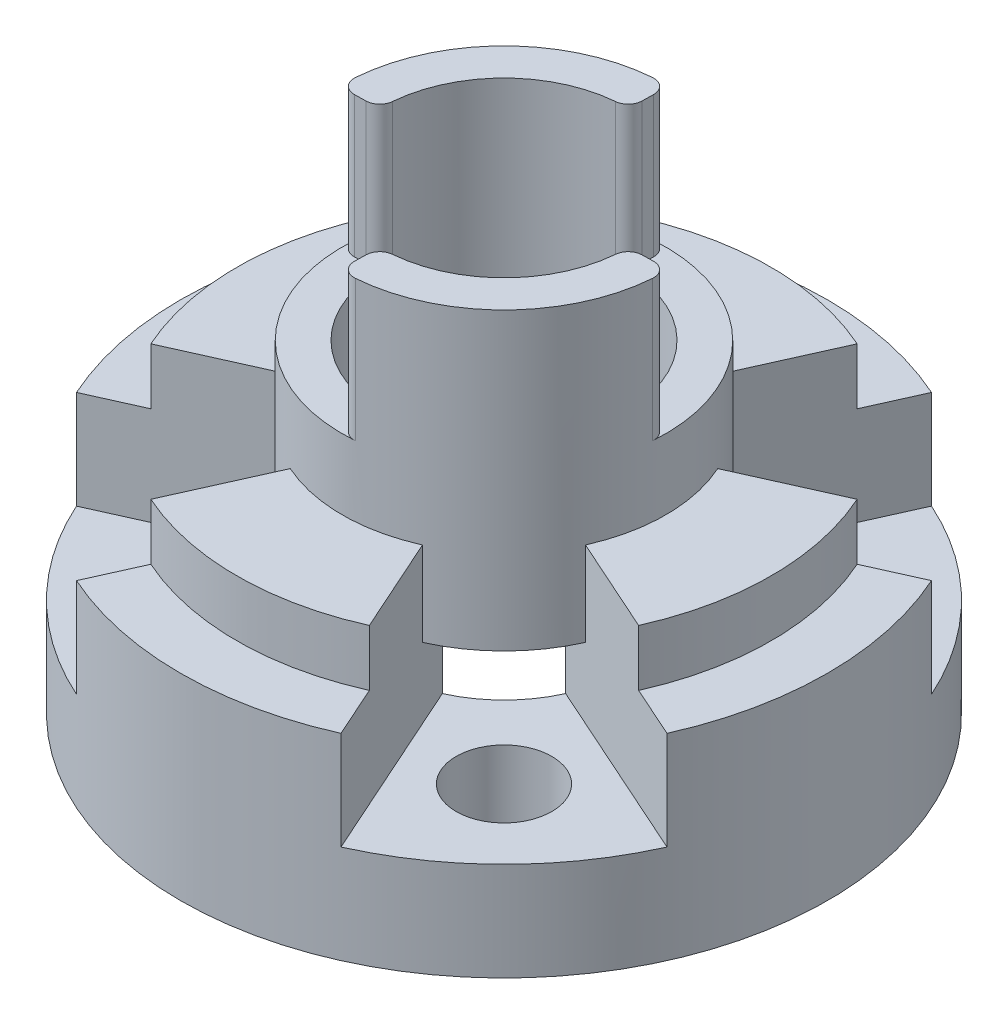
from build123d import *

# Parameters (mm, degrees)
CROQUIS1_R              = 11.5
CROQUIS1_R_2            = 4.35
CROQUIS1_R_3            = 1.7000000000000004
SALIENTE_EXTRUIR1_DEPTH = 3.5
CROQUIS2_R              = 5.75
CROQUIS2_R_2            = 4.35
SALIENTE_EXTRUIR2_DEPTH = 13
CORTAR_EXTRUIR1_START   = -5
CORTAR_EXTRUIR1_DEPTH   = 5
CROQUIS4_R              = 5.275
CROQUIS4_R_2            = 4.35
CORTAR_EXTRUIR2_DEPTH   = 2
REDONDEO1_R             = 0.6
REDONDEO2_R             = 0.5
SALIENTE_EXTRUIR3_DEPTH = 3.5
SALIENTE_EXTRUIR4_DEPTH = 2
CORTAR_EXTRUIR3_DEPTH   = 2.5


with BuildPart() as part:
    # Croquis1 → Saliente-Extruir1 (new body)
    with BuildSketch(Plane(origin=(0, 0, 0), x_dir=(1, 0, 0), z_dir=(0, 1, 0))):
        with Locations(Location((1.731948e-11, 0, 0), (0, 0, 270))):
            Circle(CROQUIS1_R)
        with Locations(Location((1.731948e-11, 0, 0), (0, 0, 270))):
            Circle(CROQUIS1_R_2, mode=Mode.SUBTRACT)
        with Locations(Location((5.656854249492441, 5.65685424949238, 0), (0, 0, 270))):
            Circle(CROQUIS1_R_3, mode=Mode.SUBTRACT)
        with Locations(Location((-5.656854249492318, 5.656854249492381, 0), (0, 0, 270))):
            Circle(CROQUIS1_R_3, mode=Mode.SUBTRACT)
        with Locations(Location((-5.656854249492318, -5.656854249492381, 0), (0, 0, 270))):
            Circle(CROQUIS1_R_3, mode=Mode.SUBTRACT)
        with Locations(Location((5.656854249492441, -5.65685424949238, 0), (0, 0, 270))):
            Circle(CROQUIS1_R_3, mode=Mode.SUBTRACT)
    extrude(amount=SALIENTE_EXTRUIR1_DEPTH)

    # Croquis2 → Saliente-Extruir2 (add)
    with BuildSketch(Plane(origin=(0, 3.5, 0), x_dir=(1, 0, 0), z_dir=(0, 1, 6e-17))):
        with Locations(Location((1.731948e-11, 0, 0), (0, 0, 90))):
            Circle(CROQUIS2_R)
        with Locations(Location((1.731948e-11, 0, 0), (0, 0, 270))):
            Circle(CROQUIS2_R_2, mode=Mode.SUBTRACT)
    extrude(amount=SALIENTE_EXTRUIR2_DEPTH)

    # Croquis3 → Cortar-Extruir1 (cut)
    with BuildSketch(Plane(origin=(0, 16.5, 1.01e-15), x_dir=(1, 0, 0), z_dir=(0, 1, 6e-17)).offset(CORTAR_EXTRUIR1_START)):
        with BuildLine():
            Line((-5.7491242471489485, -0.10035133701439494), (-4.3493374739299995, -0.07591796800219403))
            ThreePointArc((-4.3493374739299995, -0.07591796800219403), (-3.0759144981612514, -3.0759144981612847), (-0.07591796800214497, -4.34933747393))
            Line((-0.07591796800214497, -4.34933747393), (-0.10035133701433126, -5.7491242471489485))
            ThreePointArc((-0.10035133701433126, -5.7491242471489485), (-4.065863991822413, -4.065863991822457), (-5.7491242471489485, -0.10035133701439494))
        make_face()
        with BuildLine():
            Line((5.749124247183587, 0.10035133701435339), (4.349337473964638, 0.07591796800216172))
            ThreePointArc((4.349337473964638, 0.07591796800216172), (3.075914498198222, 3.0759144981732933), (0.07591796803681536, 4.3493374739299995))
            Line((0.07591796803681536, 4.3493374739299995), (0.10035133704901177, 5.749124247148948))
            ThreePointArc((0.10035133704901177, 5.749124247148948), (4.06586399185939, 4.065863991834459), (5.749124247183587, 0.10035133701435339))
        make_face()
    extrude(amount=CORTAR_EXTRUIR1_DEPTH, mode=Mode.SUBTRACT)

    # Croquis4 → Cortar-Extruir2 (cut)
    with BuildSketch(Plane.XZ):
        with Locations(Location((1.731948e-11, 0, 0), (0, 0, 270))):
            Circle(CROQUIS4_R)
        with Locations(Location((1.731948e-11, 0, 0), (0, 0, 270))):
            Circle(CROQUIS4_R_2, mode=Mode.SUBTRACT)
    extrude(amount=-CORTAR_EXTRUIR2_DEPTH, mode=Mode.SUBTRACT)

    # Redondeo1
    redondeo1_edges = [part.edges().sort_by_distance(p)[0] for p in [
        (1.732109e-11, 0, 5.275),
    ]]
    fillet(redondeo1_edges, radius=REDONDEO1_R)

    # Redondeo2
    # the kernel refuses this fillet: 0.5 mm, written as the material it takes off along each edge
    with BuildSketch(Plane(origin=(-0.10035133701433126, 11.5, 5.749124247148949), x_dir=(0.017452406437275973, 0, -0.9998476951563914), z_dir=(0, 1, 6e-17))) as redondeo2_piece_1:
        with BuildLine():
            CenterArc((0.5238637599066267, -0.5000000000000001), REDONDEO2_R, 90.00000000000004, 95.46502379971594)
            ThreePointArc((0.02613649894535296, -0.5476190476173979), (0.00653784155089456, -0.27412120398217477), (0, 0))
            Line((0, 0), (0.5238637599066264, 0))
        make_face()
    extrude(amount=6.3706060199107775, mode=Mode.SUBTRACT)
    with BuildSketch(Plane(origin=(-5.7491242471489485, 11.5, 0.10035133701439544), x_dir=(0.9998476951563913, 0, -0.01745240643728594), z_dir=(0, 1, 6e-17))) as redondeo2_piece_2:
        with BuildLine():
            CenterArc((0.5238637599253263, 0.5), REDONDEO2_R, 174.53497620009085, 95.46502379990915)
            ThreePointArc((0.02613649896421286, 0.5476190476190762), (0.00653784156877282, 0.2741212039826321), (0, 0))
            Line((0, 0), (0.5238637599253264, 0))
        make_face()
    extrude(amount=6.3706060199172185, mode=Mode.SUBTRACT)
    with BuildSketch(Plane(origin=(-4.3493374739299995, 11.5, 0.07591796800219473), x_dir=(0.03417818793243372, 0, -0.9994157550637548), z_dir=(0, 1, 6e-17))) as redondeo2_piece_3:
        with BuildLine():
            CenterArc((0.4748597695855003, 0.4993335237901514), REDONDEO2_R, 182.95864737806363, 84.08270524821285)
            Line((-0.02447375420269609, 0.47352592759711776), (0, 0))
            ThreePointArc((0, 0), (0.22452608671492605, 0.00579834302568299), (0.4490521734302907, 0))
        make_face()
    extrude(amount=6.18539489398967, mode=Mode.SUBTRACT)
    with BuildSketch(Plane(origin=(-0.07591796800214483, 11.5, 4.34933747393), x_dir=(0.9994157550651794, 0, -0.03417818789077768), z_dir=(0, 1, 6e-17))) as redondeo2_piece_4:
        with BuildLine():
            CenterArc((0.4748597696053468, -0.4993335237891691), REDONDEO2_R, 92.95864737590307, 84.082705248422)
            Line((-0.02447375418392556, -0.47352592761695317), (0, 0))
            ThreePointArc((0, 0), (0.22452608671557137, -0.0057983430342235), (0.44905217343114273, 0))
        make_face()
    extrude(amount=6.185394894036769, mode=Mode.SUBTRACT)
    with BuildSketch(Plane(origin=(0.10035133704901178, 11.5, -5.749124247148948), x_dir=(-0.017452406437283147, 0, 0.9998476951563912), z_dir=(0, 1, 6e-17))) as redondeo2_piece_5:
        with BuildLine():
            CenterArc((0.5238637599066267, -0.49999999999999994), REDONDEO2_R, 90.00000000000004, 95.46502379971594)
            ThreePointArc((0.02613649894535335, -0.5476190476173982), (0.00653784155089565, -0.27412120398217554), (0, 0))
            Line((0, 0), (0.5238637599066264, 0))
        make_face()
    extrude(amount=6.370606019910781, mode=Mode.SUBTRACT)
    with BuildSketch(Plane(origin=(5.749124247183587, 11.5, -0.10035133701435296), x_dir=(-0.9998476951563913, 0, 0.017452406437280254), z_dir=(0, 1, 6e-17))) as redondeo2_piece_6:
        with BuildLine():
            CenterArc((0.5238637599253252, 0.5000000000000001), REDONDEO2_R, 174.53497620009054, 95.46502379990937)
            ThreePointArc((0.02613649896421246, 0.5476190476190788), (0.00653784156877128, 0.27412120398263345), (0, 0))
            Line((0, 0), (0.5238637599253245, 0))
        make_face()
    extrude(amount=6.370606019917222, mode=Mode.SUBTRACT)
    with BuildSketch(Plane(origin=(4.349337473964638, 11.5, -0.07591796800216102), x_dir=(-0.03417818793243961, 0, 0.9994157550637546), z_dir=(0, 1, 6e-17))) as redondeo2_piece_7:
        with BuildLine():
            CenterArc((0.4748597695855018, 0.49933352379015083), REDONDEO2_R, 182.9586473780635, 84.08270524821285)
            Line((-0.02447375420269471, 0.4735259275971186), (0, 0))
            ThreePointArc((0, 0), (0.22452608671492558, 0.00579834302568341), (0.4490521734302912, 0))
        make_face()
    extrude(amount=6.185394893989674, mode=Mode.SUBTRACT)
    with BuildSketch(Plane(origin=(0.07591796803681525, 11.5, -4.349337473929999), x_dir=(-0.9994157550651797, 0, 0.03417818789076981), z_dir=(0, 1, 6e-17))) as redondeo2_piece_8:
        with BuildLine():
            CenterArc((0.47485976960534654, -0.4993335237891697), REDONDEO2_R, 92.9586473759031, 84.0827052484222)
            Line((-0.02447375418392593, -0.4735259276169559), (0, 0))
            ThreePointArc((0, 0), (0.22452608671556917, -0.00579834303422432), (0.4490521734311421, 0))
        make_face()
    extrude(amount=6.185394894036776, mode=Mode.SUBTRACT)

    # Croquis5 → Saliente-Extruir3 (add)
    with BuildSketch(Plane(origin=(0, 3.5, 0), x_dir=(1, 0, 0), z_dir=(0, 1, 6e-17))):
        with BuildLine():
            ThreePointArc((10.4951389110437, -4.701282722647084), (11.500000000017316, 2.423062e-11), (10.495138911023886, 4.701282722691312))
            Line((10.495138911023888, 4.701282722691313), (5.247569455520605, 2.350641361345657))
            ThreePointArc((5.247569455520605, 2.3506413613456574), (5.7500000000173195, 1.211642e-11), (5.247569455530511, -2.350641361323542))
            Line((5.247569455530511, -2.3506413613235417), (10.495138911043702, -4.701282722647084))
        make_face()
        with BuildLine():
            ThreePointArc((-4.701282722629764, -10.495138911026384), (4.155054e-11, -11.500000000000004), (4.701282722708632, -10.495138911006572))
            Line((4.701282722708633, -10.495138911006569), (2.3506413613629764, -5.247569455503285))
            ThreePointArc((2.3506413613629777, -5.247569455503285), (2.943645e-11, -5.75), (-2.350641361306222, -5.247569455513191))
            Line((-2.350641361306222, -5.247569455513191), (-4.701282722629764, -10.495138911026382))
        make_face()
        with BuildLine():
            ThreePointArc((4.701282722664406, 10.49513891102638), (-6.91114e-12, 11.5), (-4.701282722673994, 10.49513891100657))
            Line((-4.701282722673993, 10.495138911006569), (-2.3506413613283366, 5.247569455503284))
            ThreePointArc((-2.3506413613283352, 5.247569455503285), (5.20506e-12, 5.750000000000002), (2.3506413613408625, 5.24756945551319))
            Line((2.3506413613408625, 5.24756945551319), (4.701282722664406, 10.49513891102638))
        make_face()
        with BuildLine():
            ThreePointArc((-10.495138911009063, 4.7012827226470835), (-11.499999999982684, -2.423151e-11), (-10.49513891098925, -4.701282722691313))
            Line((-10.49513891098925, -4.701282722691314), (-5.247569455485966, -2.3506413613456574))
            ThreePointArc((-5.247569455485966, -2.3506413613456587), (-5.7499999999826805, -1.211753e-11), (-5.247569455495871, 2.3506413613235413))
            Line((-5.247569455495872, 2.3506413613235413), (-10.495138911009063, 4.7012827226470835))
        make_face()
    extrude(amount=SALIENTE_EXTRUIR3_DEPTH)

    # Croquis7 → Saliente-Extruir4 (add)
    with BuildSketch(Plane(origin=(0, 7, 4.8e-16), x_dir=(1, 0, 0), z_dir=(0, 1, 6e-17))):
        with BuildLine():
            Line((-5.247569455495871, 2.3506413613235413), (-8.669897361265344, 3.8836683360997637))
            ThreePointArc((-8.669897361265344, 3.8836683360997637), (-9.49999999998268, -2.001727e-11), (-8.669897361248976, -3.883668336136303))
            Line((-8.669897361248976, -3.883668336136303), (-5.247569455485966, -2.3506413613456574))
            ThreePointArc((-5.247569455485966, -2.3506413613456574), (-5.74999999998268, -1.211571e-11), (-5.247569455495871, 2.3506413613235413))
        make_face()
        with BuildLine():
            Line((2.3506413613408608, 5.24756945551319), (3.8836683361170823, 8.669897361282663))
            ThreePointArc((3.8836683361170823, 8.669897361282663), (-2.69837e-12, 9.5), (-3.883668336118984, 8.669897361266296))
            Line((-3.883668336118984, 8.669897361266296), (-2.3506413613283383, 5.247569455503285))
            ThreePointArc((-2.3506413613283383, 5.247569455503285), (5.20341e-12, 5.749999999999999), (2.3506413613408608, 5.24756945551319))
        make_face()
        with BuildLine():
            ThreePointArc((5.2475694555206065, 2.350641361345656), (5.7500000000173195, 1.211553e-11), (5.247569455530511, -2.350641361323542))
            Line((5.24756945553051, -2.3506413613235413), (8.669897361299984, -3.883668336099766))
            ThreePointArc((8.669897361299984, -3.883668336099768), (9.500000000017327, 2.001721e-11), (8.669897361283617, 3.883668336136305))
            Line((8.669897361283617, 3.883668336136302), (5.247569455520605, 2.3506413613456565))
        make_face()
        with BuildLine():
            Line((-2.350641361306222, -5.24756945551319), (-3.8836683360824447, -8.669897361282663))
            ThreePointArc((-3.8836683360824447, -8.669897361282663), (3.733849e-11, -9.5), (3.883668336153622, -8.669897361266296))
            Line((3.883668336153622, -8.669897361266296), (2.350641361362977, -5.247569455503285))
            ThreePointArc((2.350641361362977, -5.247569455503285), (2.943625e-11, -5.749999999999999), (-2.350641361306222, -5.24756945551319))
        make_face()
    extrude(amount=SALIENTE_EXTRUIR4_DEPTH)

    # Croquis8 → Cortar-Extruir3 (cut)
    with BuildSketch(Plane(origin=(0, 3.5, 0), x_dir=(1, 0, 0), z_dir=(0, 1, 6e-17))):
        with BuildLine():
            Line((-5.247569455495871, 2.3506413613235413), (-3.969900370675269, 1.7783112907404188))
            ThreePointArc((-3.969900370675269, 1.7783112907404188), (-3.0759144981506426, 3.075914498155002), (-1.7783112907398269, 3.9699003706850946))
            Line((-1.7783112907398269, 3.9699003706850946), (-2.3506413613283375, 5.247569455503285))
            ThreePointArc((-2.3506413613283375, 5.247569455503285), (-4.065863991813897, 4.065863991814082), (-5.247569455495871, 2.3506413613235413))
        make_face()
        with BuildLine():
            Line((5.247569455520605, 2.350641361345657), (3.969900370702414, 1.7783112907571466))
            ThreePointArc((3.969900370702414, 1.7783112907571466), (3.0759144981723208, 3.075914498167963), (1.778311290757738, 3.9699003706925886))
            Line((1.778311290757738, 3.9699003706925886), (2.3506413613408603, 5.24756945551319))
            ThreePointArc((2.3506413613408603, 5.24756945551319), (4.065863991831401, 4.0658639918312165), (5.247569455520605, 2.350641361345657))
        make_face()
        with BuildLine():
            Line((2.3506413613629764, -5.247569455503285), (1.7783112907744663, -3.9699003706850946))
            ThreePointArc((1.7783112907744663, -3.9699003706850946), (3.0759144981852824, -3.0759144981550013), (3.969900370709908, -1.7783112907404184))
            Line((3.969900370709908, -1.7783112907404184), (5.24756945553051, -2.350641361323541))
            ThreePointArc((5.24756945553051, -2.350641361323541), (4.065863991848536, -4.065863991814081), (2.3506413613629764, -5.247569455503285))
        make_face()
        with BuildLine():
            Line((-5.247569455485965, -2.3506413613456574), (-3.9699003706677742, -1.778311290757147))
            ThreePointArc((-3.9699003706677742, -1.778311290757147), (-3.0759144981376823, -3.0759144981679625), (-1.7783112907230985, -3.9699003706925886))
            Line((-1.7783112907230985, -3.9699003706925886), (-2.350641361306221, -5.247569455513191))
            ThreePointArc((-2.350641361306221, -5.247569455513191), (-4.0658639917967605, -4.0658639918312165), (-5.247569455485965, -2.3506413613456574))
        make_face()
    extrude(amount=CORTAR_EXTRUIR3_DEPTH, mode=Mode.SUBTRACT)


solid = part.part
